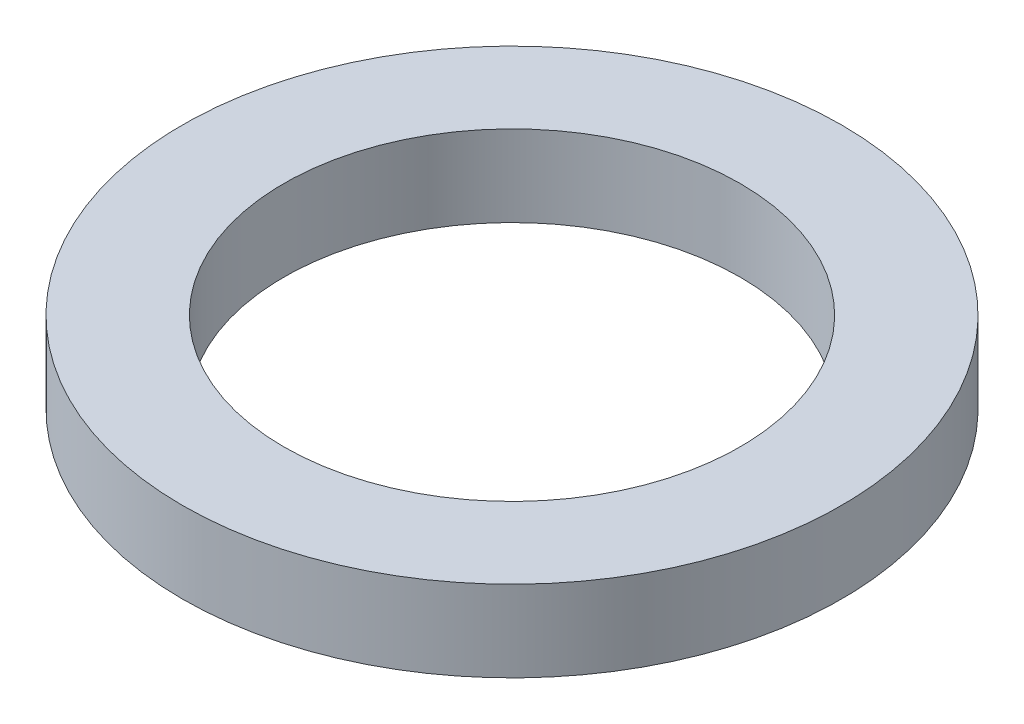
from build123d import *

# Parameters (mm, degrees)
SKETCH1_R           = 32.5
BOSS_EXTRUDE1_DEPTH = 8
SKETCH2_R           = 22.5
CUT_EXTRUDE1_DEPTH  = 47.652974182


with BuildPart() as part:
    # Sketch1 → Boss-Extrude1 (new body)
    with BuildSketch(Plane(origin=(0, 0, 0), x_dir=(1, 0, 0), z_dir=(0, 1, 0))):
        Circle(SKETCH1_R)
    extrude(amount=BOSS_EXTRUDE1_DEPTH)

    # Sketch2 → Cut-Extrude1 (cut, through all)
    with BuildSketch(Plane(origin=(0, 0, 0), x_dir=(1, 0, 0), z_dir=(0, 1, 0))):
        Circle(SKETCH2_R)
    extrude(amount=CUT_EXTRUDE1_DEPTH, mode=Mode.SUBTRACT)


solid = part.part
